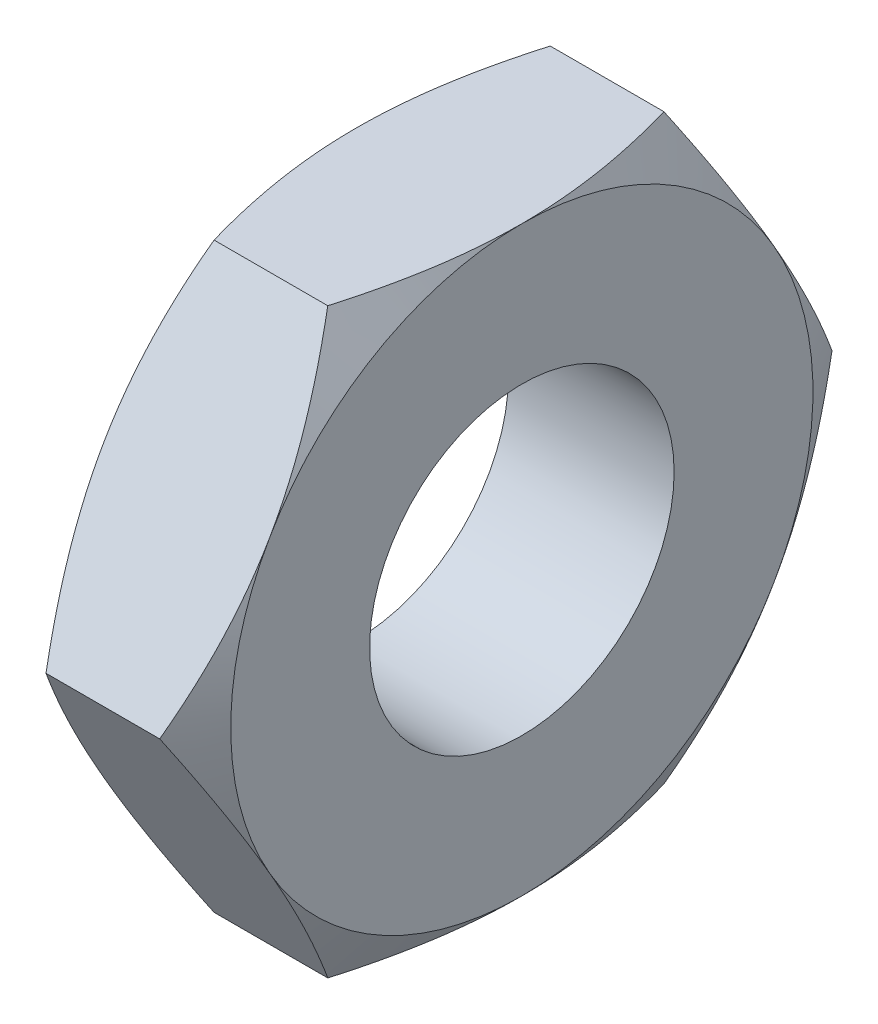
from build123d import *

# Parameters (mm, degrees)
SKETCH1_R      = 3.4
EXTRUDE1_DEPTH = 1.85


# Read off the part's stored shape, not the designer's step: Cut-Extrude1
with BuildPart() as part:
    # Sketch1 → Extrude1 (new, symmetric)
    with BuildSketch(Plane(origin=(0, 0, 0), x_dir=(0, 0, -1), z_dir=(1, 0, 0))):
        Polygon((7.505553499, 0), (3.75277675, 6.5), (-3.75277675, 6.5), (-7.505553499, 0), (-3.75277675, -6.5), (3.75277675, -6.5), align=None)
        Circle(SKETCH1_R, mode=Mode.SUBTRACT)
    extrude(amount=EXTRUDE1_DEPTH, both=True)

    # Cut-Extrude1 outline → Cut-Extrude1 (revolve, cut)
    with BuildSketch(Plane.YX):
        Polygon((7.505553503, 1.850001347), (6.499998254, 1.850001347), (7.505553503, 1.269443414), align=None)
    cut_extrude1 = revolve(axis=Axis((0, 0, 0), (1, 0, 0)), mode=Mode.SUBTRACT)

    # Mirror1: Cut-Extrude1 across plane
    add(cut_extrude1.mirror(Plane(origin=(0, 0, 0), x_dir=(0, 0, 1), z_dir=(1, 0, 0))), mode=Mode.SUBTRACT)


solid = part.part
